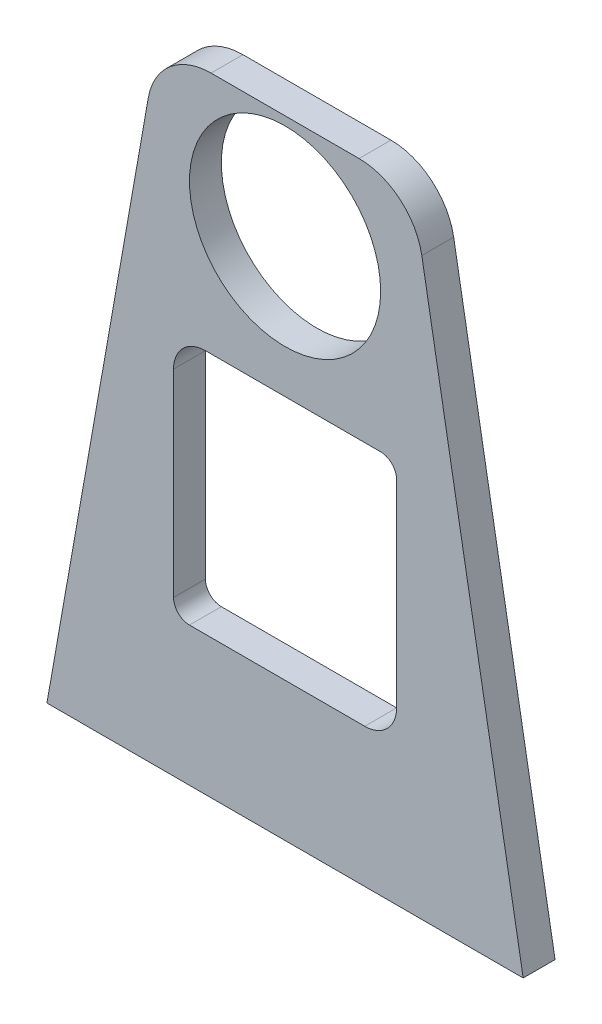
from build123d import *

# Parameters (mm, degrees)
SKETCH3_R           = 7.62
BOSS_EXTRUDE1_DEPTH = 2.54


with BuildPart() as part:
    # Sketch3 → Boss-Extrude1 (new body)
    with BuildSketch(Plane.XY):
        with BuildLine():
            Line((-18.520197259, 45.830366596), (-26.601327425, 0))
            Line((-26.601327425, 0), (11.361327425, 0))
            Line((11.361327425, 0), (3.280197259, 45.830366596))
            ThreePointArc((3.280197259, 45.830366596), (1.542734931, 48.839739624), (-1.722626126, 50.028233853))
            Line((-1.722626126, 50.028233853), (-13.517373874, 50.028233853))
            ThreePointArc((-13.517373874, 50.028233853), (-16.782734931, 48.839739624), (-18.520197259, 45.830366596))
        make_face()
        with BuildLine():
            Line((-1.27, 11.063069501), (-15.24, 11.063069501))
            ThreePointArc((-15.24, 11.063069501), (-16.138025612, 11.435043889), (-16.51, 12.333069501))
            Line((-16.51, 12.333069501), (-16.51, 28.101219778))
            ThreePointArc((-16.51, 28.101219778), (-15.766051224, 29.897271003), (-13.97, 30.641219778))
            Line((-13.97, 30.641219778), (0, 30.641219778))
            ThreePointArc((0, 30.641219778), (0.898025612, 30.26924539), (1.27, 29.371219778))
            Line((1.27, 29.371219778), (1.27, 13.603069501))
            ThreePointArc((1.27, 13.603069501), (0.526051224, 11.807018277), (-1.27, 11.063069501))
        make_face(mode=Mode.SUBTRACT)
        with Locations((-7.62, 41.713507014)):
            Circle(SKETCH3_R, mode=Mode.SUBTRACT)
    extrude(amount=BOSS_EXTRUDE1_DEPTH)


solid = part.part
